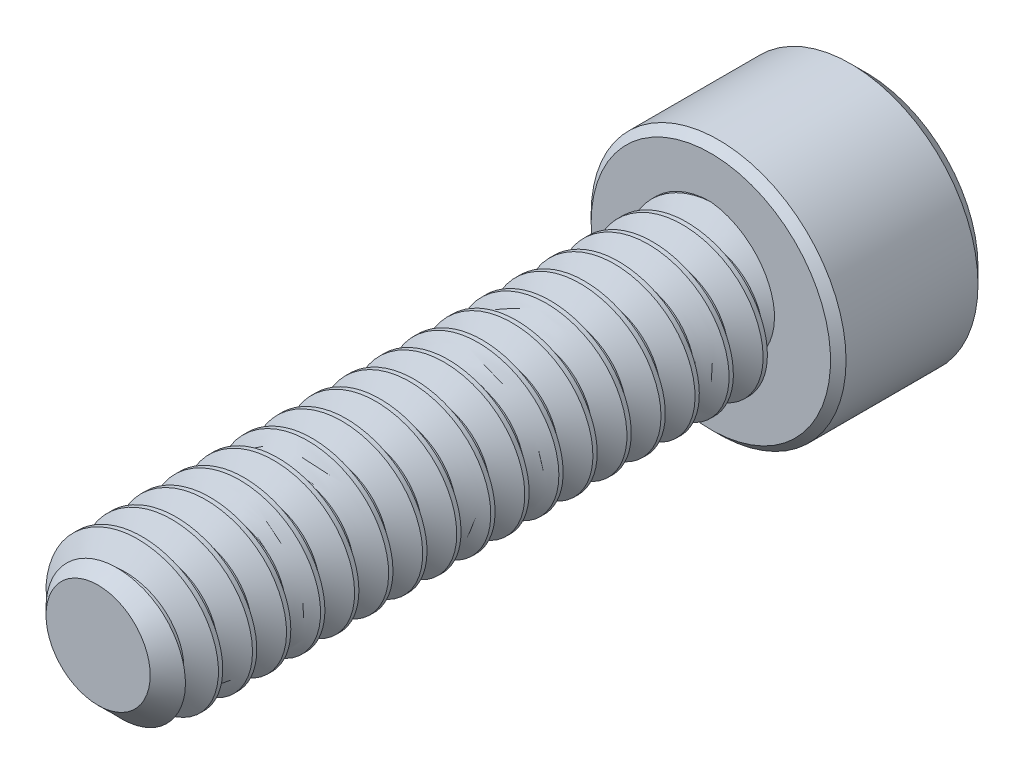
from build123d import *

# Parameters (mm, degrees)
SKETCH1_R          = 2.413
EXTRUDE1_DEPTH     = 19.05
CHAMFER3_SIZE      = 0.79375
CUT_SWEEP1_PITCH   = 1.058333333
SKETCH6_R          = 3.9624
EXTRUDE2_DEPTH     = 4.826
CUT_EXTRUDE1_DEPTH = 2.9765625
SKETCH8_R          = 2.291358881
CUT_EXTRUDE2_DEPTH = 0.4826
CUT_EXTRUDE2_DRAFT = -45
CHAMFER1_SIZE      = 0.4826
CHAMFER2_SIZE      = 0.2413


with BuildPart() as part:
    # Sketch1 → Extrude1 (new body)
    with BuildSketch(Plane.XY):
        Circle(SKETCH1_R)
    extrude(amount=-EXTRUDE1_DEPTH)

    # Chamfer3
    chamfer3_edges = [part.edges().sort_by_distance(p)[0] for p in [
        (-2.413, 0, 0),
    ]]
    chamfer(chamfer3_edges, length=CHAMFER3_SIZE)

    # Cut-Sweep1: the profile of Sketch3 profile screwed along a right-hand helix of 19 turns, 6 arcs to a turn; built about Z, then put on its axis
    cut_sweep1_z = Axis((0, 0, 0), (0, 0, 1))
    cut_sweep1_corners = [(2.4133, 0, -0.926214872), (1.725592336, 0, -0.529166667), (1.725592336, 0, -0.396875), (2.4133, 0, 0.000173205)]
    with BuildLine(mode=Mode.PRIVATE) as cut_sweep1_profile:
        Line(cut_sweep1_corners[0], cut_sweep1_corners[1])
        Line(cut_sweep1_corners[1], cut_sweep1_corners[2])
        Line(cut_sweep1_corners[2], cut_sweep1_corners[3])
        Line(cut_sweep1_corners[3], cut_sweep1_corners[0])
    cut_sweep1_cap = Face(cut_sweep1_profile.wire())
    cut_sweep1_turn_angles = [0, 30, 60, 90, 120, 150, 180, 210, 240, 270, 300, 330, 360]
    cut_sweep1_turn_weights = [1, 0.8660254037844387, 1, 0.8660254037844387, 1, 0.8660254037844387, 1, 0.8660254037844387, 1, 0.8660254037844387, 1, 0.8660254037844387, 1]
    cut_sweep1_turn_rails = [Edge.make_bspline([Vector(p[0], p[1], 0).rotate(cut_sweep1_z, cut_sweep1_turn_angles[k]) / cut_sweep1_turn_weights[k] + Vector(0, 0, p[2] + CUT_SWEEP1_PITCH * cut_sweep1_turn_angles[k] / 360) for k in range(13)], [0, 0, 0, 1, 1, 2, 2, 3, 3, 4, 4, 5, 5, 6, 6, 6], 2, cut_sweep1_turn_weights) for p in cut_sweep1_corners]
    cut_sweep1_turn_sides = [Face.make_surface_from_curves(cut_sweep1_turn_rails[p[0]], cut_sweep1_turn_rails[p[1]]) for p in [(0, 1), (1, 2), (2, 3), (3, 0)]]
    cut_sweep1 = Plane(origin=(0, 0, 0), x_dir=(0, 1, 0), z_dir=(0, 0, -1)) * Solid(Shell([*[p.moved(Location((0, 0, CUT_SWEEP1_PITCH * i))) for i in range(19) for p in cut_sweep1_turn_sides], cut_sweep1_cap, cut_sweep1_cap.rotate(cut_sweep1_z, 6840).moved(Location((0, 0, CUT_SWEEP1_PITCH * 6840 / 360)))]))
    add(cut_sweep1, mode=Mode.SUBTRACT)

    # Sketch6 → Extrude2 (add)
    with BuildSketch(Plane(origin=(0, 0, -19.05), x_dir=(-1, 0, 0), z_dir=(0, 0, -1))):
        Circle(SKETCH6_R)
    extrude(amount=EXTRUDE2_DEPTH)

    # Sketch7 → Cut-Extrude1 (cut)
    with BuildSketch(Plane(origin=(0, 0, -23.876), x_dir=(-1, 0, 0), z_dir=(0, 0, -1))):
        Polygon((0, 2.291358881), (-1.984375, 1.14567944), (-1.984375, -1.14567944), (0, -2.291358881), (1.984375, -1.14567944), (1.984375, 1.14567944), align=None)
    extrude(amount=-CUT_EXTRUDE1_DEPTH, mode=Mode.SUBTRACT)


with BuildPart() as cut_extrude2_tool:
    # Sketch8 → Cut-Extrude2 (with draft: the straight prism first)
    with BuildSketch(Plane(origin=(0, 0, -23.876), x_dir=(-1, 0, 0), z_dir=(0, 0, -1))):
        Circle(SKETCH8_R)
    extrude(amount=-CUT_EXTRUDE2_DEPTH)
    # Cut-Extrude2: the draft: its side faces are tilted about the plane it starts from
    cut_extrude2_sides = [cut_extrude2_tool.faces().sort_by_distance(p)[0] for p in [
        (2.291358881, 0, -23.6347),
    ]]
    draft(cut_extrude2_sides, Plane(origin=(0, 0, -23.876), x_dir=(-1, 0, 0), z_dir=(0, 0, -1)), CUT_EXTRUDE2_DRAFT)


with BuildPart() as part_1:
    add(part.part)

    # Cut-Extrude2: cut by cut_extrude2_tool
    add(cut_extrude2_tool.part, mode=Mode.SUBTRACT)

    # Chamfer1
    chamfer1_edges = [part_1.edges().sort_by_distance(p)[0] for p in [
        (3.9624, 0, -23.876),
    ]]
    chamfer(chamfer1_edges, length=CHAMFER1_SIZE)

    # Chamfer2
    chamfer2_edges = [part_1.edges().sort_by_distance(p)[0] for p in [
        (3.9624, 0, -19.05),
    ]]
    chamfer(chamfer2_edges, length=CHAMFER2_SIZE)


solid = part_1.part
